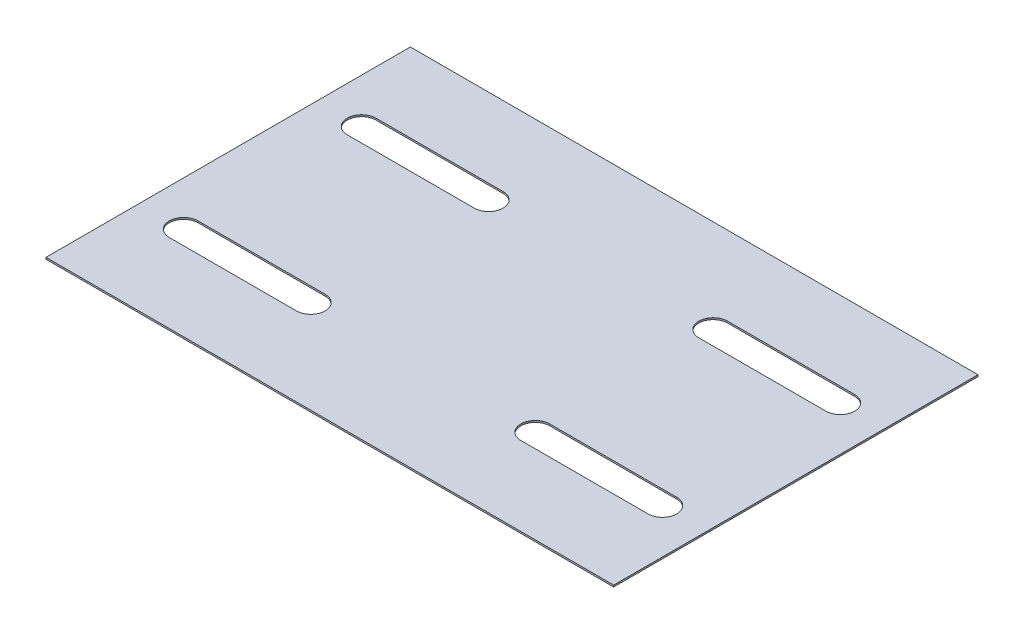
from build123d import *

# Parameters (mm, degrees)
SKETCH1_W           = 67
SKETCH1_H           = 43
BOSS_EXTRUDE1_DEPTH = 0.2


with BuildPart() as part:
    # Sketch1 → Boss-Extrude1 (new body)
    with BuildSketch(Plane(origin=(0, 0, 0), x_dir=(1, 0, 0), z_dir=(0, 1, 0))):
        Rectangle(SKETCH1_W, SKETCH1_H)
        with BuildLine():
            Line((13.25, 12.2), (28.25, 12.2))
            ThreePointArc((28.25, 12.2), (29.95, 10.5), (28.25, 8.8))
            Line((28.25, 8.8), (13.25, 8.8))
            ThreePointArc((13.25, 8.8), (11.55, 10.5), (13.25, 12.2))
        make_face(mode=Mode.SUBTRACT)
        with BuildLine():
            Line((-13.25, 12.2), (-28.25, 12.2))
            ThreePointArc((-28.25, 12.2), (-29.95, 10.5), (-28.25, 8.8))
            Line((-28.25, 8.8), (-13.25, 8.8))
            ThreePointArc((-13.25, 8.8), (-11.55, 10.5), (-13.25, 12.2))
        make_face(mode=Mode.SUBTRACT)
        with BuildLine():
            Line((-13.25, -12.2), (-28.25, -12.2))
            ThreePointArc((-28.25, -12.2), (-29.95, -10.5), (-28.25, -8.8))
            Line((-28.25, -8.8), (-13.25, -8.8))
            ThreePointArc((-13.25, -8.8), (-11.55, -10.5), (-13.25, -12.2))
        make_face(mode=Mode.SUBTRACT)
        with BuildLine():
            Line((13.25, -12.2), (28.25, -12.2))
            ThreePointArc((28.25, -12.2), (29.95, -10.5), (28.25, -8.8))
            Line((28.25, -8.8), (13.25, -8.8))
            ThreePointArc((13.25, -8.8), (11.55, -10.5), (13.25, -12.2))
        make_face(mode=Mode.SUBTRACT)
    extrude(amount=BOSS_EXTRUDE1_DEPTH)


solid = part.part
